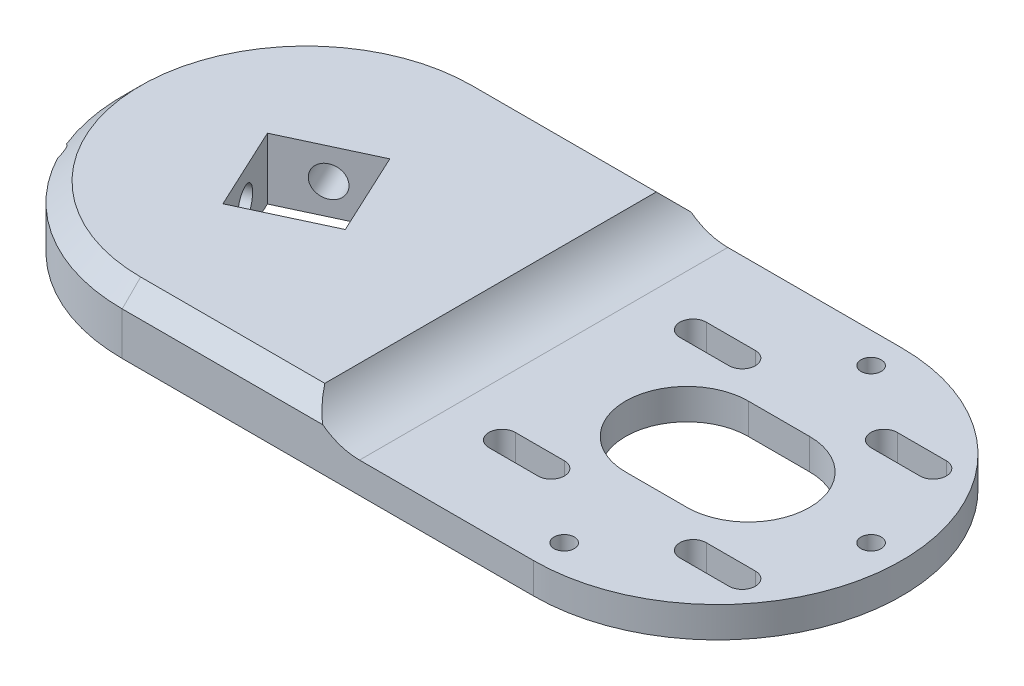
from build123d import *

# Parameters (mm, degrees)
BOSS_EXTRUDE1_DEPTH = 5
CUT_EXTRUDE1_DEPTH  = 71.407741052
BOSS_EXTRUDE2_DEPTH = 5
FILLET1_R           = 10
CUT_EXTRUDE2_DEPTH  = 71.938353519
M4_TAPPED_HOLE1_D   = 3.3
SKETCH13_W          = 2.5
SKETCH13_H          = 32.367781463
SKETCH17_W          = 2.5
SKETCH17_H          = 32.367781463
CHAMFER1_SIZE       = 3


with BuildPart() as part:
    # Sketch1 → Boss-Extrude1 (new body)
    with BuildSketch(Plane(origin=(0, 0, 0), x_dir=(1, 0, 0), z_dir=(0, 1, 0))):
        with BuildLine():
            Line((-33.5, 30), (33.5, 30))
            ThreePointArc((33.5, 30), (63.5, 0), (33.5, -30))
            Line((33.5, -30), (-33.5, -30))
            ThreePointArc((-33.5, -30), (-63.5, 0), (-33.5, 30))
        make_face()
        with BuildLine():
            Line((28.5, 10), (38.5, 10))
            ThreePointArc((38.5, 10), (48.5, 0), (38.5, -10))
            Line((38.5, -10), (28.5, -10))
            ThreePointArc((28.5, -10), (18.5, 0), (28.5, 10))
        make_face(mode=Mode.SUBTRACT)
    extrude(amount=BOSS_EXTRUDE1_DEPTH)

    # Sketch2 → Cut-Extrude1 (cut, through all)
    with BuildSketch(Plane(origin=(0, 5, 0), x_dir=(1, 0, 0), z_dir=(0, 1, 0))):
        with BuildLine():
            Line((13.943650814, 17.706349186), (21.943650814, 17.706349186))
            ThreePointArc((21.943650814, 17.706349186), (24.093650814, 15.556349186), (21.943650814, 13.406349186))
            Line((21.943650814, 13.406349186), (13.943650814, 13.406349186))
            ThreePointArc((13.943650814, 13.406349186), (11.793650814, 15.556349186), (13.943650814, 17.706349186))
        make_face()
        with BuildLine():
            Line((53.056349186, 17.706349186), (45.056349186, 17.706349186))
            ThreePointArc((45.056349186, 17.706349186), (42.906349186, 15.556349186), (45.056349186, 13.406349186))
            Line((45.056349186, 13.406349186), (53.056349186, 13.406349186))
            ThreePointArc((53.056349186, 13.406349186), (55.206349186, 15.556349186), (53.056349186, 17.706349186))
        make_face()
        with BuildLine():
            Line((53.056349186, -17.706349186), (45.056349186, -17.706349186))
            ThreePointArc((45.056349186, -17.706349186), (42.906349186, -15.556349186), (45.056349186, -13.406349186))
            Line((45.056349186, -13.406349186), (53.056349186, -13.406349186))
            ThreePointArc((53.056349186, -13.406349186), (55.206349186, -15.556349186), (53.056349186, -17.706349186))
        make_face()
        with BuildLine():
            Line((13.943650814, -17.706349186), (21.943650814, -17.706349186))
            ThreePointArc((21.943650814, -17.706349186), (24.093650814, -15.556349186), (21.943650814, -13.406349186))
            Line((21.943650814, -13.406349186), (13.943650814, -13.406349186))
            ThreePointArc((13.943650814, -13.406349186), (11.793650814, -15.556349186), (13.943650814, -17.706349186))
        make_face()
    extrude(amount=-CUT_EXTRUDE1_DEPTH, mode=Mode.SUBTRACT)

    # Sketch8 → Boss-Extrude2 (add)
    with BuildSketch(Plane(origin=(0, 5, 0), x_dir=(1, 0, 0), z_dir=(0, 1, 0))):
        with BuildLine():
            ThreePointArc((-33.5, -30), (-12.286796564, -21.213203436), (-3.5, 0))
            ThreePointArc((-3.5, 0), (-12.286796564, 21.213203436), (-33.5, 30))
            ThreePointArc((-33.5, 30), (-63.5, 0), (-33.5, -30))
        make_face()
        with BuildLine():
            Line((-3.5, 0), (-3.5, 30))
            Line((-3.5, 30), (-33.5, 30))
            ThreePointArc((-33.5, 30), (-12.286796564, 21.213203436), (-3.5, 0))
        make_face()
        with BuildLine():
            Line((-3.5, -30), (-3.5, 0))
            ThreePointArc((-3.5, 0), (-12.286796564, -21.213203436), (-33.5, -30))
            Line((-33.5, -30), (-3.5, -30))
        make_face()
    extrude(amount=BOSS_EXTRUDE2_DEPTH)

    # Fillet1
    # the kernel refuses this fillet: 10 mm, written as the material it adds along each edge
    with BuildSketch(Plane(origin=(-3.5, 5, -30), x_dir=(0, 1, 0), z_dir=(0, 0, 1))) as fillet1_piece_1:
        with BuildLine():
            CenterArc((10, -8.660254038), FILLET1_R, 120, 60)
            Line((0, -8.660254038), (-0.2, -8.660254038))
            Line((-0.2, -8.660254038), (-0.2, 0))
            Line((-0.2, 0), (0, 0.2))
            ThreePointArc((0, 0.2), (2.5, 0.2), (4.9, 0.173205081))
            Line((4.9, 0.173205081), (5, 0))
        make_face()
    extrude(amount=60)

    # Sketch9 → Cut-Extrude2 (cut, through all)
    with BuildSketch(Plane(origin=(0, 10, 0), x_dir=(1, 0, 0), z_dir=(0, 1, 0))):
        Polygon((-29.87232856, 9.966945366), (-23.533054634, -3.62767144), (-37.12767144, -9.966945366), (-43.466945366, 3.62767144), align=None)
    extrude(amount=-CUT_EXTRUDE2_DEPTH, mode=Mode.SUBTRACT)

    # M4 Tapped Hole1 (through all)
    with Locations(Plane(origin=(0, 5, 0), x_dir=(1, 0, 0), z_dir=(0, 1, 0))):
        with Locations((58.5, 0), (33.5, 25), (33.5, -25)):
            Hole(M4_TAPPED_HOLE1_D / 2)

    # Sketch13 → M6 Tapped Hole1 (revolve, cut)
    with BuildSketch(Plane(origin=(-40.297308403, 5, 3.169636963), x_dir=(-0.4226182617406973, 0, -0.9063077870366509), z_dir=(0, 1, 0))):
        with Locations((1.25, 16.183890732)):
            Rectangle(SKETCH13_W, SKETCH13_H)
    revolve(axis=Axis((-34.542253955, 5, 0.486011001), (-0.9063077870366509, 0, 0.42261826174069733)), mode=Mode.SUBTRACT)

    # Sketch17 → M6 Tapped Hole3 (revolve, cut)
    with BuildSketch(Plane(origin=(-36.669636963, 5, -6.797308403), x_dir=(0.9063077870366509, 0, -0.42261826174069766), z_dir=(0, 1, 0))):
        with Locations((1.25, 16.183890732)):
            Rectangle(SKETCH17_W, SKETCH17_H)
    revolve(axis=Axis((-33.986011001, 5, -1.042253955), (-0.42261826174069766, 0, -0.9063077870366508)), mode=Mode.SUBTRACT)

    # Chamfer1
    # the kernel refuses this chamfer: 3 mm, written as the material it takes off along each edge
    with BuildSketch(Plane(origin=(-33.5, 10, 30), x_dir=(0, 0.02749587661058619, -0.9996219169112968), z_dir=(1, 0, 0)), Plane(origin=(4.215048964, 10, -30), x_dir=(0, 0.02749587661058619, 0.9996219169112968), z_dir=(-1, 0, 0))) as chamfer1_piece_1:
        Polygon((CHAMFER1_SIZE * 0.999621916911, -CHAMFER1_SIZE * 0.0274958766106), (-CHAMFER1_SIZE * 0.0274958766106, -CHAMFER1_SIZE * 0.999621916911), (0, 0), align=None)
    extrude(amount=37.715048964, mode=Mode.SUBTRACT)
    with BuildSketch(Plane(origin=(-33.5, 10, 0), x_dir=(0, 0, 1), z_dir=(1, 0, 0))) as chamfer1_piece_2:
        Polygon((30 - CHAMFER1_SIZE, 0), (30, CHAMFER1_SIZE), (30, 0), align=None)
    revolve(axis=Axis((-33.5, 10, 0), (0, -1, 0)), revolution_arc=180, mode=Mode.SUBTRACT)


solid = part.part
